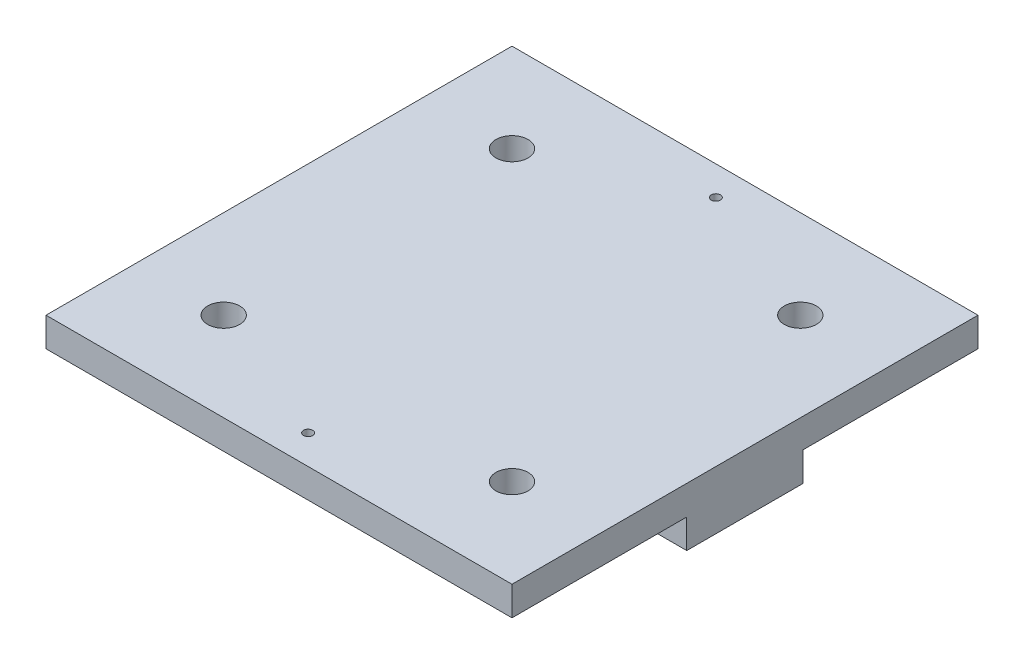
from build123d import *

# Parameters (mm, degrees)
SKETCH1_W                   = 101.6
SKETCH1_H                   = 101.6
MOUNTING_SURFACE_DEPTH      = 6.35
SKETCH7_W                   = 101.6
SKETCH7_H                   = 25.4
GRAB_FLANGE_DEPTH           = 6.35
M8X1_0_TAPPED_HOLE2_D       = 7
F_2_0MM_PRESS_DOWEL_HOLE2_D = 2


with BuildPart() as part:
    # Sketch1 → Mounting surface (new body)
    with BuildSketch(Plane(origin=(0, 0, 0), x_dir=(1, 0, 0), z_dir=(0, 1, 0))):
        Rectangle(SKETCH1_W, SKETCH1_H)
    extrude(amount=MOUNTING_SURFACE_DEPTH)

    # Sketch7 → grab flange (add)
    with BuildSketch(Plane(origin=(0, 0, 0), x_dir=(-1, 0, 0), z_dir=(0, -1, 0))):
        Rectangle(SKETCH7_W, SKETCH7_H)
    extrude(amount=GRAB_FLANGE_DEPTH)

    # M8x1.0 Tapped Hole2 (through all)
    with Locations(Plane(origin=(0, 6.35, 0), x_dir=(1, 0, 0), z_dir=(0, 1, 0))):
        with Locations((31.430896424, 31.430896424), (-31.430896424, 31.430896424), (-31.430896424, -31.430896424), (31.430896424, -31.430896424)):
            Hole(M8X1_0_TAPPED_HOLE2_D / 2)

    # Ø2.0mm Press Dowel Hole2 (through all)
    with Locations(Plane(origin=(0, 6.35, 0), x_dir=(1, 0, 0), z_dir=(0, 1, 0))):
        with Locations((0, 44.45), (0, -44.45)):
            Hole(F_2_0MM_PRESS_DOWEL_HOLE2_D / 2)


solid = part.part
